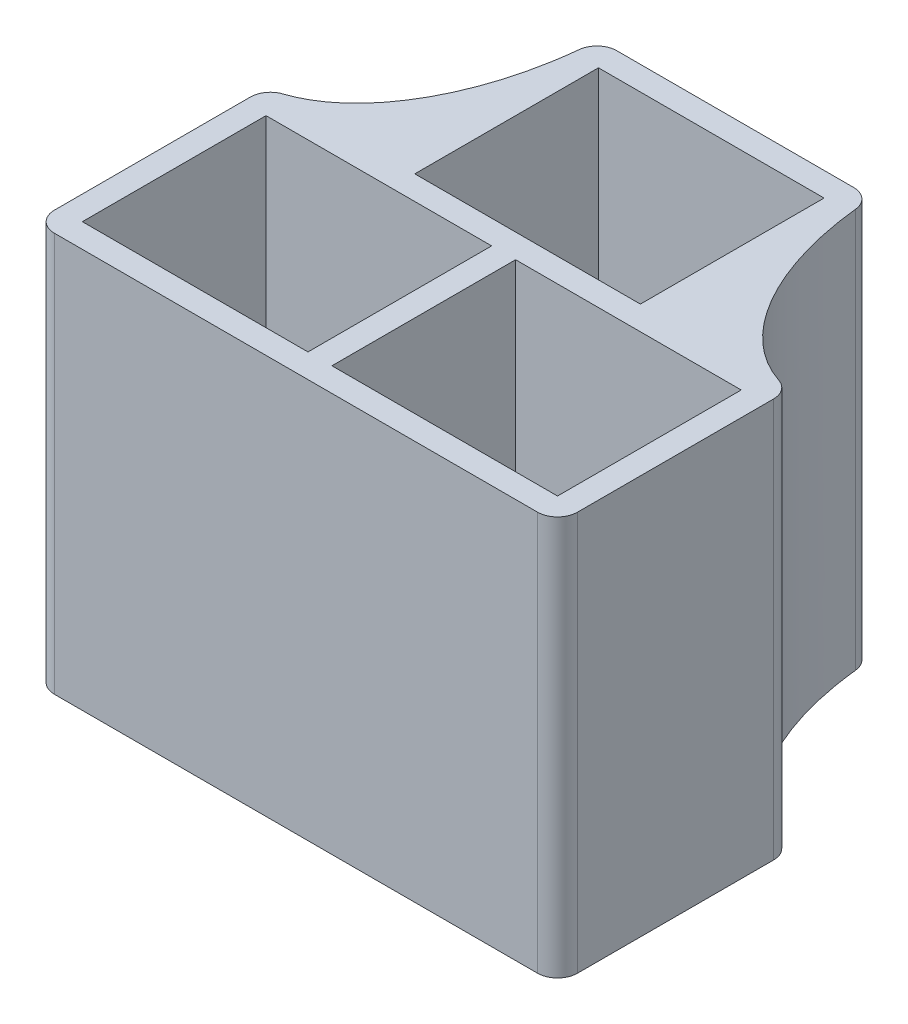
from build123d import *

# Parameters (mm, degrees)
SKETCH1_W               = 13.1
SKETCH1_H               = 5.8
BOSS_EXTRUDE1_DEPTH     = 5
SKETCH10_W              = 5.65
SKETCH10_H              = 4.6
CUT_EXTRUDE7_DEPTH      = 6.6
CUT_EXTRUDE6_DEPTH      = 9.735702605
CUT_EXTRUDE6_DEPTH_BACK = 9.735702605
SKETCH9_R               = 0.75
BOSS_EXTRUDE2_START     = -5
BOSS_EXTRUDE2_DEPTH     = 10
SKETCH12_W              = 5.65
SKETCH12_H              = 4.6
SKETCH12_R              = 0.75
BOSS_EXTRUDE3_DEPTH     = 3.4
FILLET1_START           = -5
FILLET1_DEPTH           = 10
FILLET2_R               = 0.5


with BuildPart() as part:
    # Sketch1 → Boss-Extrude1 (new, symmetric)
    with BuildSketch(Plane(origin=(0, 0, 0), x_dir=(1, 0, 0), z_dir=(0, 1, 0))):
        Rectangle(SKETCH1_W, SKETCH1_H)
    extrude(amount=BOSS_EXTRUDE1_DEPTH, both=True)

    # Sketch10 → Cut-Extrude7 (cut)
    with BuildSketch(Plane(origin=(0, 5, 0), x_dir=(1, 0, 0), z_dir=(0, 1, 0))):
        with Locations((-3.125, 0)):
            Rectangle(SKETCH10_W, SKETCH10_H)
        with Locations((3.125, 0)):
            Rectangle(SKETCH10_W, SKETCH10_H)
    extrude(amount=-CUT_EXTRUDE7_DEPTH, mode=Mode.SUBTRACT)

    # Sketch9 → Cut-Extrude6 (cut, two sides: drawn at the far end of the back side and taken through both)
    with BuildSketch(Plane(origin=(0, 0, 0), x_dir=(1, 0, 0), z_dir=(0, 1, 0)).offset(-CUT_EXTRUDE6_DEPTH_BACK)):
        with Locations(Location((-4.625, 0, 0), (0, 0, 270))):
            Circle(SKETCH9_R)
        with Locations(Location((-1.625, 0, 0), (0, 0, 270))):
            Circle(SKETCH9_R)
        with Locations(Location((1.625, 0, 0), (0, 0, 270))):
            Circle(SKETCH9_R)
        with Locations(Location((4.625, 0, 0), (0, 0, 270))):
            Circle(SKETCH9_R)
    extrude(amount=CUT_EXTRUDE6_DEPTH + CUT_EXTRUDE6_DEPTH_BACK, mode=Mode.SUBTRACT)

    # Sketch11 → Boss-Extrude2 (add)
    with BuildSketch(Plane(origin=(0, 0, 0), x_dir=(1, 0, 0), z_dir=(0, 1, 0)).offset(BOSS_EXTRUDE2_START)):
        Polygon((-3.425, 8.1), (-3.425, 2.9), (-2.825, 2.9), (-2.825, 7.5), (2.825, 7.5), (2.825, 2.9), (3.425, 2.9), (3.425, 8.1), align=None)
    extrude(amount=BOSS_EXTRUDE2_DEPTH)

    # Sketch12 → Boss-Extrude3 (add)
    with BuildSketch(Plane.XZ.offset(5)):
        with Locations((0, -5.2)):
            Rectangle(SKETCH12_W, SKETCH12_H)
        with Locations(Location((-1.5, -5.2, 0), (0, 0, 270))):
            Circle(SKETCH12_R, mode=Mode.SUBTRACT)
        with Locations(Location((1.5, -5.2, 0), (0, 0, 270))):
            Circle(SKETCH12_R, mode=Mode.SUBTRACT)
    extrude(amount=-BOSS_EXTRUDE3_DEPTH)

    # Fillet1: read off the stored shape, not the designer's step
    # Fillet1 outline → Fillet1 (add)
    with BuildSketch(Plane(origin=(0, 0, 0), x_dir=(1, 0, 0), z_dir=(0, 1, 0)).offset(FILLET1_START)):
        with BuildLine():
            add(Edge.make_bspline(
                [(3.425, 8.1), (3.699466412, 3.355749046), (6.55, 2.9)],
                knots=[0, 0, 0, 1, 1, 1], degree=2, weights=[1, 0.779308952, 1]))
            Line((3.425, 8.1), (3.425, 2.9))
            Line((3.425, 2.9), (6.55, 2.9))
        make_face()
        with BuildLine():
            Line((-3.425, 2.9), (-3.425, 8.1))
            add(Edge.make_bspline(
                [(-3.425, 8.1), (-3.699466412, 3.355749046), (-6.55, 2.9)],
                knots=[0, 0, 0, 1, 1, 1], degree=2, weights=[1, 0.779308952, 1]))
            Line((-6.55, 2.9), (-3.425, 2.9))
        make_face()
    extrude(amount=FILLET1_DEPTH)

    # Fillet2
    fillet2_edges = [part.edges().sort_by_distance(p)[0] for p in [
        (-6.55, 0, -2.9),
        (-3.425, 0, -8.1),
        (3.425, 0, -8.1),
        (6.55, 0, -2.9),
        (6.55, 0, 2.9),
        (-6.55, 0, 2.9),
    ]]
    fillet(fillet2_edges, radius=FILLET2_R)


solid = part.part
